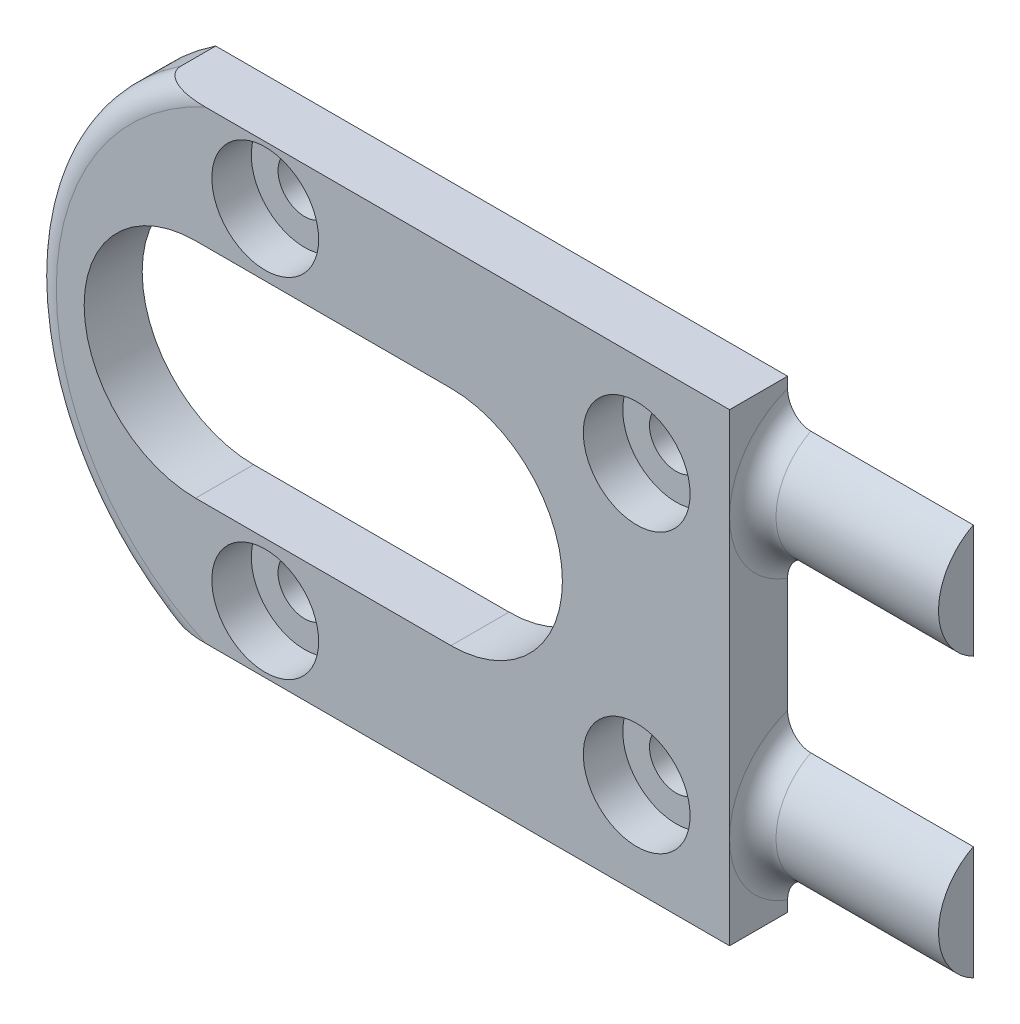
from build123d import *

# Parameters (mm, degrees)
BOSS_EXTRUDE1_DEPTH = 2.5
BOSS_EXTRUDE2_DEPTH = 8
FILLET2_R           = 1
CUT_EXTRUDE1_DEPTH  = 8
SKETCH4_R           = 2.3
CUT_EXTRUDE2_DEPTH  = 1.7
SKETCH5_R           = 1.15
CUT_EXTRUDE3_DEPTH  = 26.137422433
FILLET3_R           = 1


with BuildPart() as part:
    # Sketch1 → Boss-Extrude1 (new body)
    with BuildSketch(Plane.XY):
        with BuildLine():
            Line((15, -10), (-9.633249581, -10))
            ThreePointArc((-9.633249581, -10), (-15, 0), (-9.633249581, 10))
            Line((-9.633249581, 10), (15, 10))
            Line((15, 10), (15, -10))
        make_face()
    extrude(amount=BOSS_EXTRUDE1_DEPTH)

    # Sketch2 → Boss-Extrude2 (add)
    with BuildSketch(Plane(origin=(15, 0, 0), x_dir=(0, 0, -1), z_dir=(1, 0, 0))):
        with BuildLine():
            Line((0, -8.449489743), (0, -3.550510257))
            ThreePointArc((0, -3.550510257), (-1.5, -6), (0, -8.449489743))
        make_face()
        with BuildLine():
            Line((0, 3.550510257), (0, 8.449489743))
            ThreePointArc((0, 8.449489743), (-1.5, 6), (0, 3.550510257))
        make_face()
    extrude(amount=BOSS_EXTRUDE2_DEPTH)

    # Fillet2
    fillet2_edges = [part.edges().sort_by_distance(p)[0] for p in [
        (15, -6, 1.5),
        (15, 6, 1.5),
    ]]
    fillet(fillet2_edges, radius=FILLET2_R - 0.0001)  # a hair under: the kernel refuses the full size

    # Sketch3 → Cut-Extrude1 (cut)
    with BuildSketch(Plane(origin=(0, 0, 0), x_dir=(-1, 0, 0), z_dir=(0, 0, -1))):
        with BuildLine():
            Line((8, -4.8), (-3, -4.8))
            ThreePointArc((-3, -4.8), (-7.8, 0), (-3, 4.8))
            Line((-3, 4.8), (8, 4.8))
            ThreePointArc((8, 4.8), (12.8, 0), (8, -4.8))
        make_face()
    extrude(amount=-CUT_EXTRUDE1_DEPTH, mode=Mode.SUBTRACT)

    # Sketch4 → Cut-Extrude2 (cut)
    with BuildSketch(Plane.XY.offset(2.5)):
        with Locations((-5, 7.5)):
            Circle(SKETCH4_R)
        with Locations((11, 6)):
            Circle(SKETCH4_R)
        with Locations((11, -6)):
            Circle(SKETCH4_R)
        with Locations((-5, -7.5)):
            Circle(SKETCH4_R)
    extrude(amount=-CUT_EXTRUDE2_DEPTH, mode=Mode.SUBTRACT)

    # Sketch5 → Cut-Extrude3 (cut, through all)
    with BuildSketch(Plane.XY.offset(0.8)):
        with Locations((-5, 7.5)):
            Circle(SKETCH5_R)
        with Locations((11, 6)):
            Circle(SKETCH5_R)
        with Locations((11, -6)):
            Circle(SKETCH5_R)
        with Locations((-5, -7.5)):
            Circle(SKETCH5_R)
    extrude(amount=-CUT_EXTRUDE3_DEPTH, mode=Mode.SUBTRACT)

    # Fillet3
    fillet3_edges = [part.edges().sort_by_distance(p)[0] for p in [
        (-15, 0, 2.5),
    ]]
    fillet(fillet3_edges, radius=FILLET3_R)


solid = part.part
